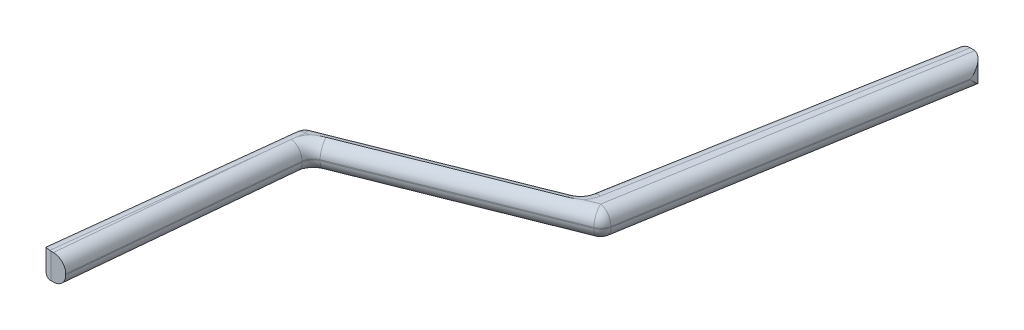
from build123d import *

# Parameters (mm, degrees)
RESSALTO_EXTRUS_O1_DEPTH = 0.27
FILETE2_R                = 0.13


with BuildPart() as part:
    # Esboço1 → Ressalto-extrusão1 (new body)
    with BuildSketch(Plane(origin=(0, 0, 0), x_dir=(1, 0, 0), z_dir=(0, 1, 0))):
        Polygon((-0.272513318, 3.234203787), (0.314684076, 6.7), (0.021085379, 6.7), (0, 6.7), (-0.603963749, 3.35), (-2.713451347, 2.506232841), (-3, 0), (-2.7, 0), (-2.475283392, 2.353124871), (-0.518320279, 3.135884251), align=None)
    extrude(amount=RESSALTO_EXTRUS_O1_DEPTH)

    # Filete2
    # the kernel refuses this fillet: 0.13 mm, written as the material it adds along each edge
    with BuildSketch(Plane(origin=(-2.475283392, 0, -2.353124871), x_dir=(-0.0950646065596586, 0, 0.9954711048441623), z_dir=(0, 1, 0))) as filete2_piece_1:
        with BuildLine():
            CenterArc((FILETE2_R * 0.609734486381, FILETE2_R), FILETE2_R, 207.255794996, 62.744205004)
            Line((-FILETE2_R * 0.279236340383, FILETE2_R * 0.542036170465), (0, 0))
            Line((0, 0), (FILETE2_R * 0.609734486381, 0))
        make_face()
    extrude(amount=0.27)
    with BuildSketch(Plane(origin=(-0.603963749, 0, -3.35), x_dir=(-0.9284809223662713, 0, 0.37138009747680073), z_dir=(0, 1, 0))) as filete2_piece_2:
        with BuildLine():
            CenterArc((FILETE2_R * 0.554072981115, -FILETE2_R), FILETE2_R, 90, 57.979304495)
            Line((-FILETE2_R * 0.293783650389, -FILETE2_R * 0.469774451376), (0, 0))
            Line((0, 0), (FILETE2_R * 0.554072981115, 0))
        make_face()
    extrude(amount=0.27)
    # the kernel refuses this fillet: 0.13 mm, written as the material it takes off along each edge
    with BuildSketch(Plane(origin=(-2.593109265, 0.13, -2.414354436), x_dir=(-0.3713800974768016, 0, -0.9284809223662711), z_dir=(0, -1, 0))) as filete2_2_piece_1_section:
        Polygon((0, 0), (FILETE2_R, 0), (FILETE2_R, -FILETE2_R * 0.597027041994), (FILETE2_R * 0.474446418292, -FILETE2_R * 0.880284383691), align=None)
    filete2_2_piece_1 = extrude(amount=FILETE2_R, mode=Mode.PRIVATE)
    filete2_2_piece_1 = filete2_2_piece_1 - Plane(origin=(-2.593109265, 0.13, -2.414354436), x_dir=(0.7948289276830398, 0, 0.6068335650886731), z_dir=(0, -1, 0)) * Sphere(FILETE2_R, mode=Mode.PRIVATE)
    add(filete2_2_piece_1, mode=Mode.SUBTRACT)
    with BuildSketch(Plane(origin=(-0.388504479, 0.13, -3.327822502), x_dir=(0.9859491340163403, 0, 0.16704581746463637), z_dir=(0, -1, 0))) as filete2_2_piece_2_section:
        Polygon((0, 0), (FILETE2_R, 0), (FILETE2_R, FILETE2_R * 0.560980407137), (FILETE2_R * 0.521260740175, FILETE2_R * 0.853397469385), align=None)
    filete2_2_piece_2 = extrude(amount=FILETE2_R, mode=Mode.PRIVATE)
    filete2_2_piece_2 = filete2_2_piece_2 - Plane(origin=(-0.388504479, 0.13, -3.327822502), x_dir=(-0.7781590553418893, 0, -0.6280672611985266), z_dir=(0, -1, 0)) * Sphere(FILETE2_R, mode=Mode.PRIVATE)
    add(filete2_2_piece_2, mode=Mode.SUBTRACT)
    with BuildSketch(Plane(origin=(-0.388504479, 0.14, -3.327822502), x_dir=(0.9859491340163403, 0, 0.16704581746463637), z_dir=(0, 1, 0))) as filete2_2_piece_3_section:
        Polygon((0, 0), (FILETE2_R, 0), (FILETE2_R, -FILETE2_R * 0.560980407137), (FILETE2_R * 0.521260740175, -FILETE2_R * 0.853397469385), align=None)
    filete2_2_piece_3 = extrude(amount=FILETE2_R, mode=Mode.PRIVATE)
    filete2_2_piece_3 = filete2_2_piece_3 - Plane(origin=(-0.388504479, 0.14, -3.327822502), x_dir=(-0.7781590553418893, 0, -0.6280672611985266), z_dir=(0, 1, 0)) * Sphere(FILETE2_R, mode=Mode.PRIVATE)
    add(filete2_2_piece_3, mode=Mode.SUBTRACT)
    with BuildSketch(Plane(origin=(-2.593109265, 0.14, -2.414354436), x_dir=(-0.3713800974768016, 0, -0.9284809223662711), z_dir=(0, 1, 0))) as filete2_2_piece_4_section:
        Polygon((0, 0), (FILETE2_R, 0), (FILETE2_R, FILETE2_R * 0.597027041994), (FILETE2_R * 0.474446418292, FILETE2_R * 0.880284383691), align=None)
    filete2_2_piece_4 = extrude(amount=FILETE2_R, mode=Mode.PRIVATE)
    filete2_2_piece_4 = filete2_2_piece_4 - Plane(origin=(-2.593109265, 0.14, -2.414354436), x_dir=(0.7948289276830398, 0, 0.6068335650886731), z_dir=(0, 1, 0)) * Sphere(FILETE2_R, mode=Mode.PRIVATE)
    add(filete2_2_piece_4, mode=Mode.SUBTRACT)
    with BuildSketch(Plane(origin=(-2.722267803, 0, -2.429121702), x_dir=(0.9935272135866853, 0, 0.11359434784652435), z_dir=(-0.11359434784652435, 0, 0.9935272135866853))) as filete2_2_piece_5:
        with BuildLine():
            CenterArc((FILETE2_R, FILETE2_R), FILETE2_R, 180, 90)
            Line((0, FILETE2_R), (0, 0))
            Line((0, 0), (FILETE2_R, 0))
        make_face()
    extrude(amount=2.769947324, mode=Mode.SUBTRACT)
    with BuildSketch(Plane(origin=(-0.670841754, 0, -3.323249682), x_dir=(0.3713800974768015, 0, 0.9284809223662709), z_dir=(-0.9284809223662711, 0, 0.3713800974768016))) as filete2_2_piece_6:
        with BuildLine():
            CenterArc((FILETE2_R, FILETE2_R), FILETE2_R, 180, 90)
            Line((0, FILETE2_R), (0, 0))
            Line((0, 0), (FILETE2_R, 0))
        make_face()
    extrude(amount=2.122334317, mode=Mode.SUBTRACT)
    with BuildSketch(Plane(origin=(0.057663849, 0, -7.019843525), x_dir=(0.9841339231865321, 0, 0.17742722799357663), z_dir=(-0.17742722799357666, 0, 0.9841339231865323))) as filete2_2_piece_7:
        with BuildLine():
            CenterArc((FILETE2_R, FILETE2_R), FILETE2_R, 180, 90)
            Line((0, FILETE2_R), (0, 0))
            Line((0, 0), (FILETE2_R, 0))
        make_face()
    extrude(amount=3.656978769, mode=Mode.SUBTRACT)
    with BuildSketch(Plane(origin=(-0.260331092, 0, -3.306106546), x_dir=(0, 1, 0), z_dir=(0.16704581746463637, 0, -0.9859491340163403))) as filete2_2_piece_8:
        with BuildLine():
            CenterArc((FILETE2_R, -FILETE2_R), FILETE2_R, 90, 90)
            Line((0, -FILETE2_R), (0, 0))
            Line((0, 0), (FILETE2_R, 0))
        make_face()
    extrude(amount=3.767260191, mode=Mode.SUBTRACT)
    with BuildSketch(Plane(origin=(0.057663849, 0.27, -7.019843525), x_dir=(0.9841339231865321, 0, 0.17742722799357663), z_dir=(-0.17742722799357666, 0, 0.9841339231865323))) as filete2_2_piece_9:
        with BuildLine():
            CenterArc((FILETE2_R, -FILETE2_R), FILETE2_R, 90, 90)
            Line((0, -FILETE2_R), (0, 0))
            Line((0, 0), (FILETE2_R, 0))
        make_face()
    extrude(amount=3.656978769, mode=Mode.SUBTRACT)
    with BuildSketch(Plane(origin=(-0.272513318, 0.13, -3.234203787), x_dir=(0.16704581746463568, 0, -0.9859491340163404), z_dir=(0, 1, 0))) as filete2_2_piece_10:
        with BuildLine():
            CenterArc((FILETE2_R * 0.560980407137, FILETE2_R), FILETE2_R, 211.416857509, 58.583142491)
            Line((-FILETE2_R * 0.292417062248, FILETE2_R * 0.478739259825), (0, 0))
            Line((0, 0), (FILETE2_R * 0.560980407137, 0))
        make_face()
    extrude(amount=0.01, mode=Mode.SUBTRACT)
    with BuildSketch(Plane(origin=(-3, -0.364276044, 0), x_dir=(0.11359434784652375, 0, -0.9935272135866854), z_dir=(0, 1, 0))) as filete2_2_piece_11:
        with BuildLine():
            CenterArc((FILETE2_R * 1.1208493664, -FILETE2_R), FILETE2_R, 90, 96.522555827)
            Line((FILETE2_R * 0.12732215281, -FILETE2_R * 1.11359434785), (0, 0))
            Line((0, 0), (FILETE2_R * 1.1208493664, 0))
        make_face()
    extrude(amount=0.998552088, mode=Mode.SUBTRACT)
    with BuildSketch(Plane(origin=(-2.713451347, 0.13, -2.506232841), x_dir=(0.9284809223662704, 0, -0.3713800974768032), z_dir=(0, 1, 0))) as filete2_2_piece_12:
        with BuildLine():
            CenterArc((FILETE2_R * 0.597027041994, -FILETE2_R), FILETE2_R, 90, 61.676687502)
            Line((-FILETE2_R * 0.283257341697, -FILETE2_R * 0.525553581708), (0, 0))
            Line((0, 0), (FILETE2_R * 0.597027041994, 0))
        make_face()
    extrude(amount=0.01, mode=Mode.SUBTRACT)
    with BuildSketch(Plane(origin=(0, -0.271646109, -6.7), x_dir=(1, 0, 0), z_dir=(0, 1, 0))) as filete2_2_piece_13:
        with BuildLine():
            CenterArc((FILETE2_R * 0.835834181331, -FILETE2_R), FILETE2_R, 90, 79.780061166)
            Line((-FILETE2_R * 0.148299741856, -FILETE2_R * 0.822572772006), (0, 0))
            Line((0, 0), (FILETE2_R * 0.835834181331, 0))
        make_face()
    extrude(amount=0.813292218, mode=Mode.SUBTRACT)
    with BuildSketch(Plane(origin=(0.314684076, -0.384695191, -6.7), x_dir=(-0.16704581746463687, 0, 0.9859491340163402), z_dir=(0, 1, 0))) as filete2_2_piece_14:
        with BuildLine():
            CenterArc((FILETE2_R * 1.18367751155, -FILETE2_R), FILETE2_R, 90, 99.616100838)
            Line((FILETE2_R * 0.197728377531, -FILETE2_R * 1.16704581746), (0, 0))
            Line((0, 0), (FILETE2_R * 1.18367751155, 0))
        make_face()
    extrude(amount=1.039390383, mode=Mode.SUBTRACT)
    with BuildSketch(Plane(origin=(-0.670841754, 0.27, -3.323249682), x_dir=(0.3713800974768015, 0, 0.9284809223662709), z_dir=(-0.9284809223662711, 0, 0.3713800974768016))) as filete2_2_piece_15:
        with BuildLine():
            CenterArc((FILETE2_R, -FILETE2_R), FILETE2_R, 90, 90)
            Line((0, -FILETE2_R), (0, 0))
            Line((0, 0), (FILETE2_R, 0))
        make_face()
    extrude(amount=2.122334317, mode=Mode.SUBTRACT)
    with BuildSketch(Plane(origin=(-2.722267803, 0.27, -2.429121702), x_dir=(0.9935272135866853, 0, 0.11359434784652435), z_dir=(-0.11359434784652435, 0, 0.9935272135866853))) as filete2_2_piece_16:
        with BuildLine():
            CenterArc((FILETE2_R, -FILETE2_R), FILETE2_R, 90, 90)
            Line((0, -FILETE2_R), (0, 0))
            Line((0, 0), (FILETE2_R, 0))
        make_face()
    extrude(amount=2.769947324, mode=Mode.SUBTRACT)
    with BuildSketch(Plane(origin=(-2.730895997, 0.27, 0.323528109), x_dir=(-0.9954711048441621, 0, -0.09506460655966084), z_dir=(0.09506460655966086, 0, -0.9954711048441622))) as filete2_2_piece_17:
        with BuildLine():
            CenterArc((FILETE2_R, -FILETE2_R), FILETE2_R, 90, 90)
            Line((0, -FILETE2_R), (0, 0))
            Line((0, 0), (FILETE2_R, 0))
        make_face()
    extrude(amount=2.609564928, mode=Mode.SUBTRACT)
    with BuildSketch(Plane(origin=(-0.340225066, 0.27, -3.207119982), x_dir=(0, -1, 0), z_dir=(-0.928480922366271, 0, 0.37138009747680173)), Plane(origin=(-2.401686903, 0, -2.382562494), x_dir=(0, 1, 0), z_dir=(0.928480922366271, 0, -0.37138009747680173))) as filete2_2_piece_18:
        with BuildLine():
            CenterArc((FILETE2_R, -FILETE2_R), FILETE2_R, 90, 90)
            Line((0, -FILETE2_R), (0, 0))
            Line((0, 0), (FILETE2_R, 0))
        make_face()
    extrude(amount=2.220252228, mode=Mode.SUBTRACT)
    with BuildSketch(Plane(origin=(-0.260331092, 0.27, -3.306106546), x_dir=(0, -1, 0), z_dir=(0.16704581746463637, 0, -0.9859491340163403))) as filete2_2_piece_19:
        with BuildLine():
            CenterArc((FILETE2_R, FILETE2_R), FILETE2_R, 180, 90)
            Line((0, FILETE2_R), (0, 0))
            Line((0, 0), (FILETE2_R, 0))
        make_face()
    extrude(amount=3.767260191, mode=Mode.SUBTRACT)
    with BuildSketch(Plane(origin=(-2.730895997, 0, 0.323528109), x_dir=(-0.9954711048441621, 0, -0.09506460655966084), z_dir=(0.09506460655966086, 0, -0.9954711048441622))) as filete2_2_piece_20:
        with BuildLine():
            CenterArc((FILETE2_R, FILETE2_R), FILETE2_R, 180, 90)
            Line((0, FILETE2_R), (0, 0))
            Line((0, 0), (FILETE2_R, 0))
        make_face()
    extrude(amount=2.609564928, mode=Mode.SUBTRACT)
    with BuildSketch(Plane(origin=(-2.35340749, 0, -2.261859974), x_dir=(-0.9954711048441621, 0, -0.09506460655966179), z_dir=(-0.09506460655966179, 0, 0.9954711048441621))) as filete2_2_piece_21:
        with BuildLine():
            CenterArc((0.13 + FILETE2_R, -FILETE2_R), FILETE2_R, 90, 90)
            Line((0.13, -FILETE2_R), (0.13, 0))
            Line((0.13, 0), (0.13 + FILETE2_R, 0))
        make_face()
    revolve(axis=Axis((-2.35340749, 0, -2.261859974), (0, -1, 0)), revolution_arc=62.744205004, mode=Mode.SUBTRACT)
    with BuildSketch(Plane(origin=(-2.35340749, 0.27, -2.261859974), x_dir=(-0.9954711048441621, 0, -0.09506460655966179), z_dir=(-0.09506460655966179, 0, 0.9954711048441621))) as filete2_2_piece_22:
        with BuildLine():
            CenterArc((0.13 + FILETE2_R, FILETE2_R), FILETE2_R, 180, 90)
            Line((0.13, FILETE2_R), (0.13, 0))
            Line((0.13, 0), (0.13 + FILETE2_R, 0))
        make_face()
    revolve(axis=Axis((-2.35340749, 0.27, -2.261859974), (0, -1, 0)), revolution_arc=62.744205004, mode=Mode.SUBTRACT)
    with BuildSketch(Plane(origin=(-0.719121167, 0.27, -3.443952202), x_dir=(0.37138009747680156, 0, 0.9284809223662711), z_dir=(-0.9284809223662711, 0, 0.37138009747680156))) as filete2_2_piece_23:
        with BuildLine():
            CenterArc((0.13 + FILETE2_R, -FILETE2_R), FILETE2_R, 90, 90)
            Line((0.13, -FILETE2_R), (0.13, 0))
            Line((0.13, 0), (0.13 + FILETE2_R, 0))
        make_face()
    revolve(axis=Axis((-0.719121167, 0.27, -3.443952202), (0, 1, 0)), revolution_arc=57.979304495, mode=Mode.SUBTRACT)
    with BuildSketch(Plane(origin=(-0.719121167, 0, -3.443952202), x_dir=(0.37138009747680156, 0, 0.9284809223662711), z_dir=(-0.9284809223662711, 0, 0.37138009747680156))) as filete2_2_piece_24:
        with BuildLine():
            CenterArc((0.13 + FILETE2_R, FILETE2_R), FILETE2_R, 180, 90)
            Line((0.13, FILETE2_R), (0.13, 0))
            Line((0.13, 0), (0.13 + FILETE2_R, 0))
        make_face()
    revolve(axis=Axis((-0.719121167, 0, -3.443952202), (0, 1, 0)), revolution_arc=57.979304495, mode=Mode.SUBTRACT)


solid = part.part
